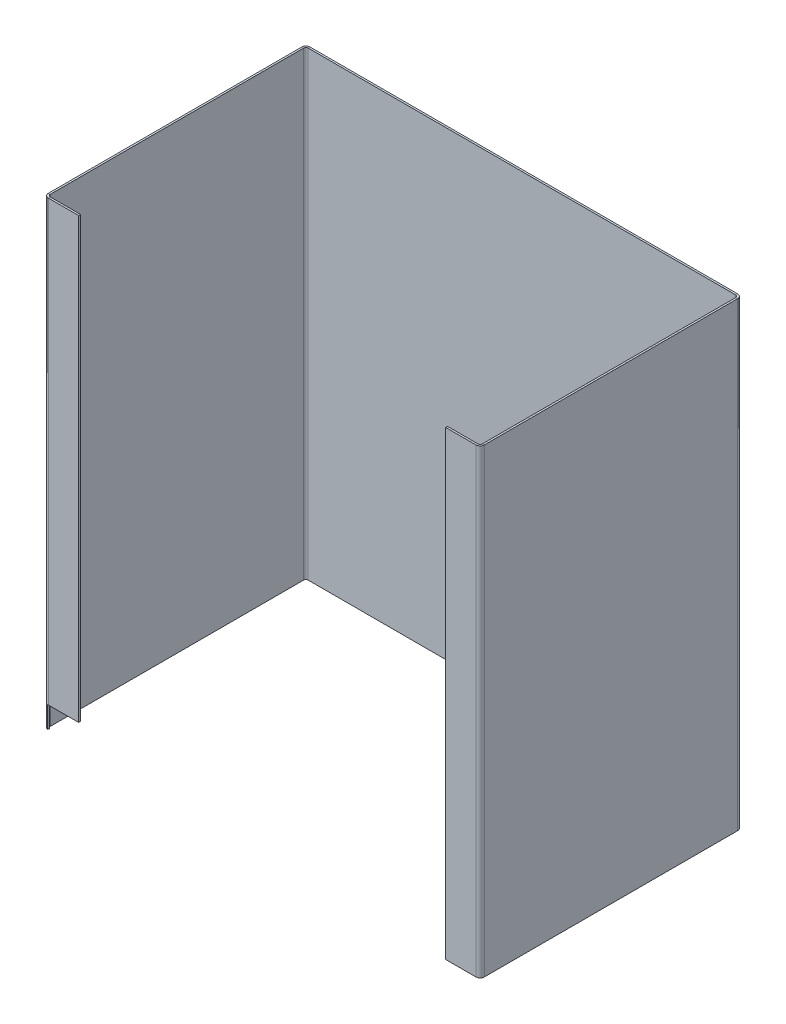
from build123d import *

# Parameters (mm, degrees)
BASE_FLANGE1_DEPTH     = 0.6
SKETCHED_BEND1_DEPTH   = 148
SKETCHED_START         = 7
SKETCHED_BEND1_2_DEPTH = 141
SKETCHED_BEND1_3_DEPTH = 7


# Read off the part's stored shape, not the designer's step: Sketched Bend1
# Sheet-metal steps are written as plain solids
with BuildPart() as part:
    # Sketch1 → Base-Flange1 (new body)
    with BuildSketch(Plane.XY):
        Polygon((0, 7), (10, 7), (10, 0), (326, 0), (326, 148), (0, 148), align=None)
    extrude(amount=BASE_FLANGE1_DEPTH)

    # Sketched Bend1 outline → Sketched Bend1 (cut)
    with BuildSketch(Plane(origin=(0, 0, 0), x_dir=(1, 0, 0), z_dir=(0, 1, 0))):
        with BuildLine():
            ThreePointArc((93.221288384, -0.6), (93.703370184, -0.159519051), (94.3366, 0))
            Line((94.3366, 0), (0, 0))
            Line((0, 0), (0, -0.6))
            Line((0, -0.6), (93.221288384, -0.6))
        make_face()
        with BuildLine():
            ThreePointArc((231.6634, 0), (232.296629816, -0.159519051), (232.778711616, -0.6))
            Line((232.778711616, -0.6), (326, -0.6))
            Line((326, -0.6), (326, 0))
            Line((326, 0), (231.6634, 0))
        make_face()
    extrude(amount=SKETCHED_BEND1_DEPTH, mode=Mode.SUBTRACT)

    # Sketched Bend1 2 outline → Sketched Bend1 2 (add)
    with BuildSketch(Plane(origin=(0, 0, 0), x_dir=(1, 0, 0), z_dir=(0, 1, 0)).offset(SKETCHED_START)):
        with BuildLine():
            Line((93.6, -82.708312528), (93.6, -1.3366))
            ThreePointArc((93.6, -1.3366), (93.815745145, -0.815745145), (94.3366, -0.6))
            Line((94.3366, -0.6), (93.221288384, -0.6))
            ThreePointArc((93.221288384, -0.6), (93.056516982, -0.952039176), (93, -1.3366))
            Line((93, -1.3366), (93, -82.708312528))
            ThreePointArc((93, -82.708312528), (93.391481076, -83.653431451), (94.3366, -84.044912528))
            Line((94.3366, -84.044912528), (104.044912528, -84.044912528))
            Line((104.044912528, -84.044912528), (104.044912528, -83.444912528))
            Line((104.044912528, -83.444912528), (94.3366, -83.444912528))
            ThreePointArc((94.3366, -83.444912528), (93.815745145, -83.229167383), (93.6, -82.708312528))
        make_face()
        with BuildLine():
            Line((232.778711616, -0.6), (231.6634, -0.6))
            ThreePointArc((231.6634, -0.6), (232.184254855, -0.815745145), (232.4, -1.3366))
            Line((232.4, -1.3366), (232.4, -82.708312528))
            ThreePointArc((232.4, -82.708312528), (232.184254855, -83.229167383), (231.6634, -83.444912528))
            Line((231.6634, -83.444912528), (221.955087472, -83.444912528))
            Line((221.955087472, -83.444912528), (221.955087472, -84.044912528))
            Line((221.955087472, -84.044912528), (231.6634, -84.044912528))
            ThreePointArc((231.6634, -84.044912528), (232.608518924, -83.653431451), (233, -82.708312528))
            Line((233, -82.708312528), (233, -1.3366))
            ThreePointArc((233, -1.3366), (232.943483018, -0.952039176), (232.778711616, -0.6))
        make_face()
    extrude(amount=SKETCHED_BEND1_2_DEPTH)

    # Sketched Bend1 3 outline → Sketched Bend1 3 (add)
    with BuildSketch(Plane(origin=(0, 0, 0), x_dir=(1, 0, 0), z_dir=(0, 1, 0))):
        with BuildLine():
            Line((93.6, -82.708312528), (93.6, -1.3366))
            ThreePointArc((93.6, -1.3366), (93.815745145, -0.815745145), (94.3366, -0.6))
            Line((94.3366, -0.6), (93.221288384, -0.6))
            ThreePointArc((93.221288384, -0.6), (93.056516982, -0.952039176), (93, -1.3366))
            Line((93, -1.3366), (93, -82.708312528))
            ThreePointArc((93, -82.708312528), (93.268285315, -83.511558003), (93.965439614, -83.992345054))
            Line((93.965439614, -83.992345054), (94.132053583, -83.415942603))
            ThreePointArc((94.132053583, -83.415942603), (93.747851985, -83.150980953), (93.6, -82.708312528))
        make_face()
        with BuildLine():
            Line((232.778711616, -0.6), (231.6634, -0.6))
            ThreePointArc((231.6634, -0.6), (232.184254855, -0.815745145), (232.4, -1.3366))
            Line((232.4, -1.3366), (232.4, -82.708312528))
            ThreePointArc((232.4, -82.708312528), (232.184254855, -83.229167383), (231.6634, -83.444912528))
            Line((231.6634, -83.444912528), (221.955087472, -83.444912528))
            Line((221.955087472, -83.444912528), (221.955087472, -84.044912528))
            Line((221.955087472, -84.044912528), (231.6634, -84.044912528))
            ThreePointArc((231.6634, -84.044912528), (232.608518924, -83.653431451), (233, -82.708312528))
            Line((233, -82.708312528), (233, -1.3366))
            ThreePointArc((233, -1.3366), (232.943483018, -0.952039176), (232.778711616, -0.6))
        make_face()
    extrude(amount=SKETCHED_BEND1_3_DEPTH)


solid = part.part
